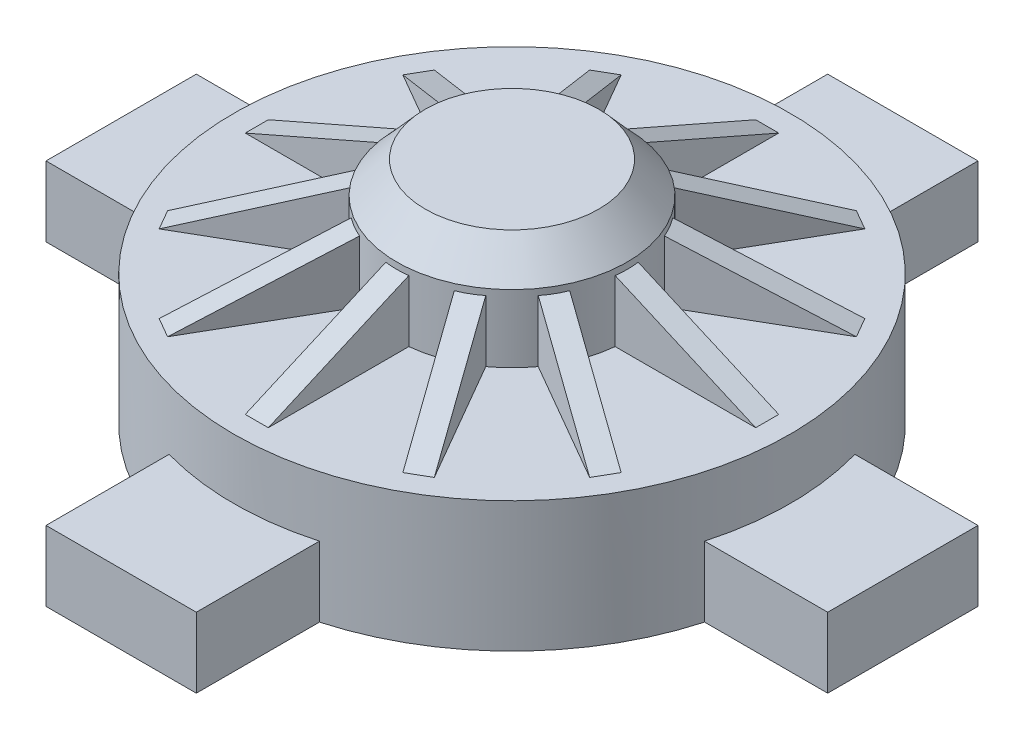
from build123d import *

# Parameters (mm, degrees)
SALIENTE_EXTRUIR1_DEPTH = 7
CROQUIS2_R              = 27.75
SALIENTE_EXTRUIR2_DEPTH = 6
CROQUIS3_R              = 11.5
SALIENTE_EXTRUIR3_DEPTH = 6.7
NERVIO5_START           = -18.11144548
NERVIO5_OUTLINE_W       = 2.3
NERVIO5_OUTLINE_H       = 7.124259241
NERVIO5_DEPTH           = 15.309418884
MATRIZC1_COUNT          = 12
CROQUIS5_R              = 8.65
SALIENTE_EXTRUIR4_DEPTH = 3.2
CHAFL_N1_SIZE           = 2.9
CHAFL_N1_SIZE_2         = 3.2


# Read off the part's stored shape, not the designer's step: Nervio5
with BuildPart() as part:
    # Croquis1 → Saliente-Extruir1 (new body)
    with BuildSketch(Plane(origin=(0, 0, 0), x_dir=(1, 0, 0), z_dir=(0, 1, 0))):
        with BuildLine():
            Line((-7.5, -39), (7.5, -39))
            Line((7.5, -39), (7.5, -26.717269696))
            ThreePointArc((7.5, -26.717269696), (19.622213178, -19.622213178), (26.717269696, -7.5))
            Line((26.717269696, -7.5), (39, -7.5))
            Line((39, -7.5), (39, 7.5))
            Line((39, 7.5), (26.717269696, 7.5))
            ThreePointArc((26.717269696, 7.5), (19.622213178, 19.622213178), (7.5, 26.717269696))
            Line((7.5, 26.717269696), (7.5, 39))
            Line((7.5, 39), (-7.5, 39))
            Line((-7.5, 39), (-7.5, 26.717269696))
            ThreePointArc((-7.5, 26.717269696), (-19.622213178, 19.622213178), (-26.717269696, 7.5))
            Line((-26.717269696, 7.5), (-39, 7.5))
            Line((-39, 7.5), (-39, -7.5))
            Line((-39, -7.5), (-26.717269696, -7.5))
            ThreePointArc((-26.717269696, -7.5), (-19.622213178, -19.622213178), (-7.5, -26.717269696))
            Line((-7.5, -26.717269696), (-7.5, -39))
        make_face()
    extrude(amount=SALIENTE_EXTRUIR1_DEPTH)

    # Croquis2 → Saliente-Extruir2 (add)
    with BuildSketch(Plane(origin=(0, 7, 0), x_dir=(1, 0, 0), z_dir=(0, 1, 0))):
        with Locations(Location((0, 0, 0), (0, 0, 105.680350135))):
            Circle(CROQUIS2_R)
    extrude(amount=SALIENTE_EXTRUIR2_DEPTH)

    # Croquis3 → Saliente-Extruir3 (add)
    with BuildSketch(Plane(origin=(0, 13, 0), x_dir=(1, 0, 0), z_dir=(0, 1, 0))):
        with Locations(Location((0, 0, 0), (0, 0, 270))):
            Circle(CROQUIS3_R)
    extrude(amount=SALIENTE_EXTRUIR3_DEPTH)

    # Nervio5 outline → Nervio5 (add)
    with BuildSketch(Plane(origin=(0, 0, 0), x_dir=(1, 0, 0), z_dir=(0, 0.4011747826314881, 0.9160015249881293)).offset(NERVIO5_START)):
        with Locations((0, 18.562129621)):
            Rectangle(NERVIO5_OUTLINE_W, NERVIO5_OUTLINE_H)
    nervio5 = extrude(amount=NERVIO5_DEPTH)

    # MatrizC1: Nervio5 ×12 about axis
    matrizc1_axis = Axis((0, 0, 0), (0, 1, 0))
    for i in range(1, MATRIZC1_COUNT):
        add(nervio5.rotate(matrizc1_axis, i * 360 / MATRIZC1_COUNT))

    # Croquis5 → Saliente-Extruir4 (add)
    with BuildSketch(Plane(origin=(0, 19.7, 0), x_dir=(1, 0, 0), z_dir=(0, 1, 0))):
        with Locations(Location((0, 0, 0), (0, 0, 270))):
            Circle(CROQUIS5_R)
    extrude(amount=SALIENTE_EXTRUIR4_DEPTH)

    # Chaflán1
    # the kernel refuses this chamfer: 3.2, 2.9 mm, written as the material it adds along each edge
    with BuildSketch(Plane(origin=(0, 19.7, 0), x_dir=(0, 0, 1), z_dir=(-1, 0, 0))) as chafl_n1_piece_1_section:
        Polygon((8.65 + CHAFL_N1_SIZE, 0), (8.65, CHAFL_N1_SIZE_2), (8.65, 0), align=None)
    chafl_n1_piece_1 = revolve(axis=Axis((0, 19.7, 0), (0, 1, 0)), mode=Mode.PRIVATE)
    chafl_n1_piece_1 = chafl_n1_piece_1 & Plane(origin=(0, 21.282250987, 0), x_dir=(0, 0, 1), z_dir=(0, -1, 0)) * Cylinder(11.5, 47, mode=Mode.PRIVATE)
    chafl_n1_piece_1 = split(chafl_n1_piece_1, bisect_by=Plane(origin=(0, 22.9, -10.02497493), z_dir=(0, -1, 0)), keep=Keep.TOP, mode=Mode.PRIVATE)
    add(chafl_n1_piece_1)


solid = part.part
